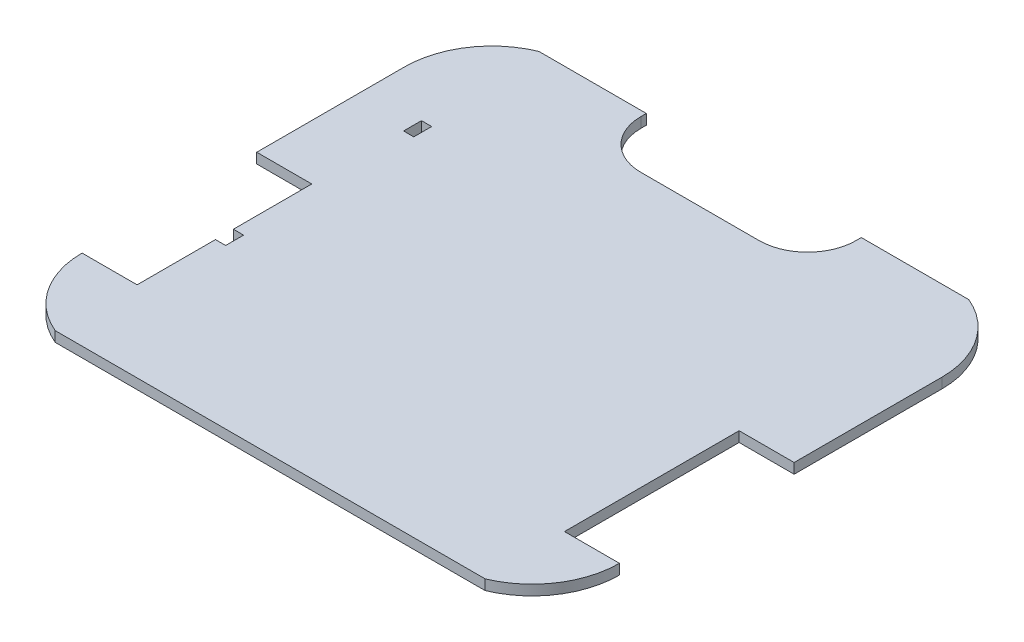
from build123d import *

# Parameters (mm, degrees)
SKETCH1_W           = 254
SKETCH1_H           = 228.6
BOSS_EXTRUDE1_DEPTH = 4.826
SKETCH2_W           = 26.00000007
SKETCH2_H           = 82.55
CUT_EXTRUDE1_DEPTH  = 4.826
CUT_EXTRUDE3_DEPTH  = 4.826
SKETCH7_W           = 101.6
SKETCH7_H           = 25.4
CUT_EXTRUDE5_DEPTH  = 4.826
FILLET9_R           = 22.86
FILLET10_R          = 22.86
CUT_EXTRUDE6_DEPTH  = 4.826
SKETCH19_W          = 4.826
SKETCH19_H          = 8.466666666
CUT_EXTRUDE16_DEPTH = 171.929167423


with BuildPart() as part:
    # Sketch1 → Boss-Extrude1 (new body)
    with BuildSketch(Plane(origin=(0, 0, 0), x_dir=(1, 0, 0), z_dir=(0, 1, 0))):
        Rectangle(SKETCH1_W, SKETCH1_H)
    extrude(amount=BOSS_EXTRUDE1_DEPTH)

    # Sketch2 → Cut-Extrude1 (cut)
    with BuildSketch(Plane(origin=(0, 4.826, 0), x_dir=(1, 0, 0), z_dir=(0, 1, 0))):
        with Locations((-113.999999965, -34.925)):
            Rectangle(SKETCH2_W, SKETCH2_H)
        with Locations((113.999999965, -34.925)):
            Rectangle(SKETCH2_W, SKETCH2_H)
    extrude(amount=-CUT_EXTRUDE1_DEPTH, mode=Mode.SUBTRACT)

    # Sketch4 → Cut-Extrude3 (cut)
    with BuildSketch(Plane(origin=(0, 4.826, 0), x_dir=(1, 0, 0), z_dir=(0, 1, 0))):
        with BuildLine():
            Line((-127, 76.2), (-127, 114.3))
            Line((-127, 114.3), (-101.6, 114.3))
            ThreePointArc((-101.6, 114.3), (-120.067875899, 99.095250599), (-127, 76.2))
        make_face()
        with BuildLine():
            Line((127, 76.2), (127, 114.3))
            Line((127, 114.3), (101.6, 114.3))
            ThreePointArc((101.6, 114.3), (120.067875899, 99.095250599), (127, 76.2))
        make_face()
    extrude(amount=-CUT_EXTRUDE3_DEPTH, mode=Mode.SUBTRACT)

    # Sketch7 → Cut-Extrude5 (cut)
    with BuildSketch(Plane(origin=(0, 4.826, 0), x_dir=(1, 0, 0), z_dir=(0, 1, 0))):
        with Locations((0, 101.6)):
            Rectangle(SKETCH7_W, SKETCH7_H)
    extrude(amount=-CUT_EXTRUDE5_DEPTH, mode=Mode.SUBTRACT)

    # Fillet9
    fillet9_edges = [part.edges().sort_by_distance(p)[0] for p in [
        (-50.8, 2.413, -88.9),
    ]]
    fillet(fillet9_edges, radius=FILLET9_R)

    # Fillet10
    fillet10_edges = [part.edges().sort_by_distance(p)[0] for p in [
        (50.8, 2.413, -88.9),
    ]]
    fillet(fillet10_edges, radius=FILLET10_R)

    # Sketch8 → Cut-Extrude6 (cut)
    with BuildSketch(Plane(origin=(0, 4.826, 0), x_dir=(1, 0, 0), z_dir=(0, 1, 0))):
        with BuildLine():
            Line((-127, -76.2), (-127, -114.3))
            Line((-127, -114.3), (-101.6, -114.3))
            ThreePointArc((-101.6, -114.3), (-120.067875899, -99.095250599), (-127, -76.2))
        make_face()
        with BuildLine():
            Line((127, -114.3), (101.6, -114.3))
            ThreePointArc((101.6, -114.3), (120.067875899, -99.095250599), (127, -76.2))
            Line((127, -76.2), (127, -114.3))
        make_face()
    extrude(amount=-CUT_EXTRUDE6_DEPTH, mode=Mode.SUBTRACT)

    # Sketch19 → Cut-Extrude16 (cut, through all)
    with BuildSketch(Plane(origin=(0, 4.826, 0), x_dir=(1, 0, 0), z_dir=(0, 1, 0))):
        with Locations((-98.58699993, -34.925)):
            Rectangle(SKETCH19_W, SKETCH19_H)
        with Locations((-98.58699993, 53.975)):
            Rectangle(SKETCH19_W, SKETCH19_H)
    extrude(amount=-CUT_EXTRUDE16_DEPTH, mode=Mode.SUBTRACT)


solid = part.part
